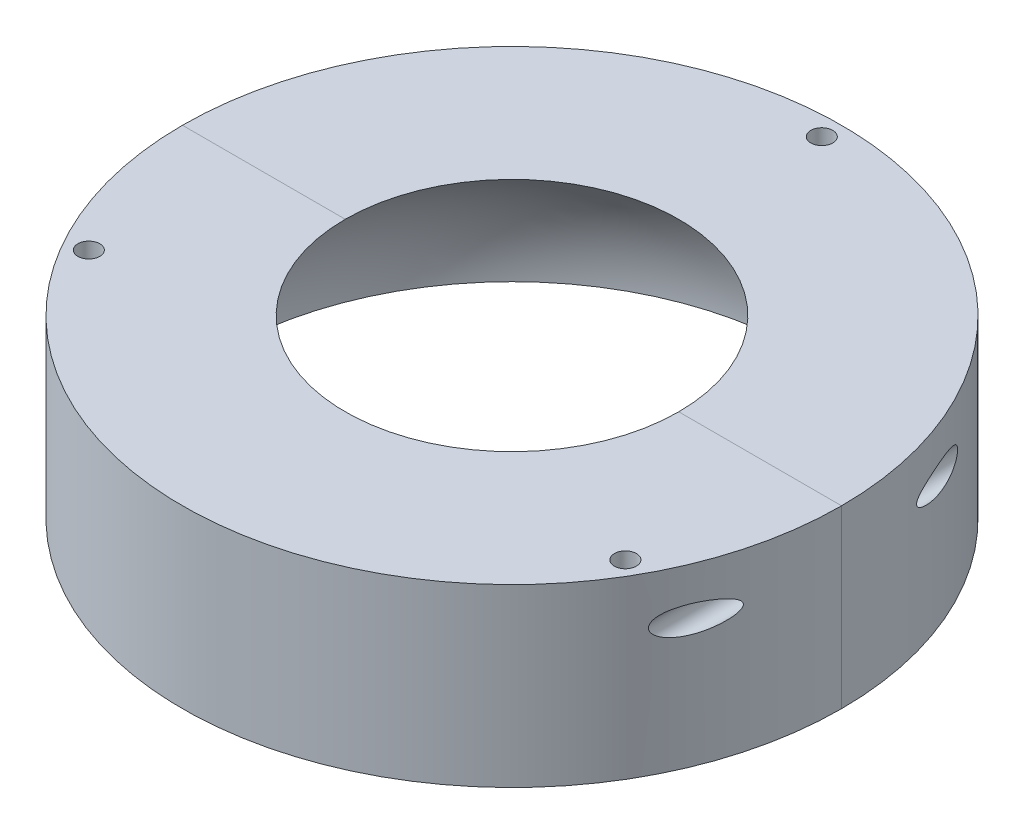
from build123d import *

# Parameters (mm, degrees)
SKETCH1_R           = 95.25
BOSS_EXTRUDE1_DEPTH = 25.4
CUT_EXTRUDE3_START  = -25.4
SKETCH6_R           = 3.175
CUT_EXTRUDE3_DEPTH  = 25.4
CIRPATTERN1_COUNT   = 3
SKETCH7_R           = 3.175
CUT_EXTRUDE4_DEPTH  = 144.964457521
CIRPATTERN2_COUNT   = 3
SKETCH8_R           = 3.891794663
CUT_EXTRUDE5_DEPTH  = 63.5


# Read off the part's stored shape, not the designer's step: Cavity1
with BuildPart() as part:
    # Sketch1 → Boss-Extrude1 (new, symmetric)
    with BuildSketch(Plane(origin=(0, 0, 0), x_dir=(1, 0, 0), z_dir=(0, 1, 0))):
        with Locations(Location((0, 0, 0), (0, 0, 270))):
            Circle(SKETCH1_R)
    extrude(amount=BOSS_EXTRUDE1_DEPTH, both=True)

    # Cavity1 outline → Cavity1 (revolve, cut)
    with BuildSketch(Plane.XY):
        with BuildLine():
            Line((0, -25.4), (83.820002599, -25.4))
            ThreePointArc((83.820002599, -25.4), (75.968533234, 2.439210437), (54.728107607, 22.073657924))
            Line((54.728107607, 22.073657924), (48.199793705, 25.4))
            Line((48.199793705, 25.4), (0, 25.4))
            Line((0, 25.4), (0, -25.4))
        make_face()
    revolve(axis=Axis((0, 0, 0), (0, 1, 0)), mode=Mode.SUBTRACT)


with BuildPart() as body_2:
    # Split1: the piece on the far side of the plane
    add(part.part)
    split(bisect_by=Plane.XY, keep=Keep.BOTTOM)


with BuildPart() as part_1:
    add(part.part)

    # Split1
    split(bisect_by=Plane.XY, keep=Keep.TOP)

    # Sketch6 → Cut-Extrude3 (cut)
    with BuildSketch(Plane(origin=(0, -25.4, 0), x_dir=(-1, 0, 0), z_dir=(0, -1, 0)).offset(CUT_EXTRUDE3_START)):
        with Locations(Location((0, -89.535, 0), (0, 0, 270))):
            Circle(SKETCH6_R)
    cut_extrude3 = extrude(amount=CUT_EXTRUDE3_DEPTH, mode=Mode.SUBTRACT)

    # Sketch7 → Cut-Extrude4 (cut, through all)
    with BuildSketch(Plane(origin=(0, -25.4, 0), x_dir=(-1, 0, 0), z_dir=(0, -1, 0))):
        with Locations(Location((-77.539584528, -44.7675, 0), (0, 0, 90))):
            Circle(SKETCH7_R)
    cut_extrude4 = extrude(amount=-CUT_EXTRUDE4_DEPTH, mode=Mode.SUBTRACT)


with BuildPart() as body_2_1:
    add(body_2.part)

    # CirPattern1: Cut-Extrude3 ×3 about axis
    cirpattern1_axis = Axis((0, 0, 0), (0, 1, 0))
    for i in range(1, CIRPATTERN1_COUNT):
        add(cut_extrude3.rotate(cirpattern1_axis, i * 360 / CIRPATTERN1_COUNT), mode=Mode.SUBTRACT)


with BuildPart() as cirpattern2_tool:
    # CirPattern2: Cut-Extrude4 ×3 about axis
    cirpattern2_axis = Axis((0, 0, 0), (0, 1, 0))
    for i in range(1, CIRPATTERN2_COUNT):
        add(cut_extrude4.rotate(cirpattern2_axis, i * 360 / CIRPATTERN2_COUNT))


with BuildPart() as part_2:
    add(part_1.part)

    # CirPattern2: cut by cirpattern2_tool
    add(cirpattern2_tool.part, mode=Mode.SUBTRACT)


with BuildPart() as body_2_2:
    add(body_2_1.part)

    # CirPattern2: cut by cirpattern2_tool
    add(cirpattern2_tool.part, mode=Mode.SUBTRACT)


with BuildPart() as cut_extrude5_tool:
    # Sketch8 → Cut-Extrude5 (new, symmetric)
    with BuildSketch(Plane.XY):
        with Locations((-88.011, 11.578188828)):
            Circle(SKETCH8_R)
    cut_extrude5 = extrude(amount=CUT_EXTRUDE5_DEPTH, both=True)


with BuildPart() as part_3:
    add(part_2.part)

    # Cut-Extrude5: cut by cut_extrude5_tool
    add(cut_extrude5_tool.part, mode=Mode.SUBTRACT)


with BuildPart() as body_2_3:
    add(body_2_2.part)

    # Cut-Extrude5: cut by cut_extrude5_tool
    add(cut_extrude5_tool.part, mode=Mode.SUBTRACT)


with BuildPart() as mirror1_tool:
    # Mirror1: Cut-Extrude5 across plane
    add(cut_extrude5.mirror(Plane(origin=(0, 0, 0), x_dir=(0, 0, 1), z_dir=(1, 0, 0))))


with BuildPart() as part_4:
    add(part_3.part)

    # Mirror1: cut by mirror1_tool
    add(mirror1_tool.part, mode=Mode.SUBTRACT)


with BuildPart() as body_2_4:
    add(body_2_3.part)

    # Mirror1: cut by mirror1_tool
    add(mirror1_tool.part, mode=Mode.SUBTRACT)


solid = Compound([part_4.part, body_2_4.part])
